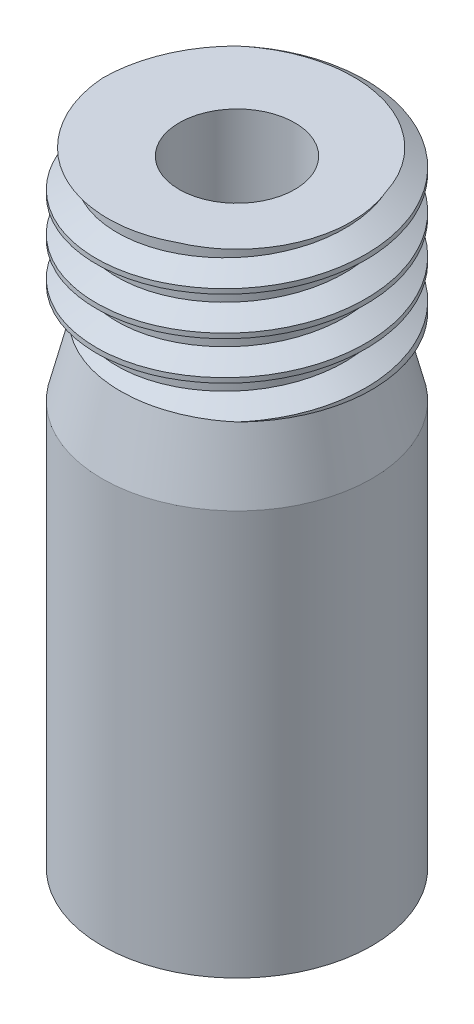
from build123d import *

# Parameters (mm, degrees)
MAINBODYS_R              = 3.5
MAIN_BODY_DEPTH          = 16
CONTACTETCHS_R           = 2.5
CONTACTETCHS_R_2         = 2
CONTACT_ETCH_DEPTH       = 0.01
ARMATURECONTACTS_R       = 1
ARMATURECONTACTS_R_2     = 0.75
ARMATURE_CONTACT_DEPTH   = 0.1
ARMATURETHRUHOLES_R      = 0.75
ARMATURE_THRU_HOLE_DEPTH = 17.748134224
BORES_R                  = 1.5
BORE_DEPTH               = 13
M7_X_5_PITCH             = 1


with BuildPart() as part:
    # MainBodyS → MAIN BODY (new body)
    with BuildSketch(Plane(origin=(0, 0, 0), x_dir=(1, 0, 0), z_dir=(0, 1, 0))):
        with Locations(Location((0, 0, 0), (0, 0, 270))):
            Circle(MAINBODYS_R)
    extrude(amount=MAIN_BODY_DEPTH)

    # ContactEtchS → CONTACT ETCH (cut)
    with BuildSketch(Plane.XZ):
        with Locations(Location((0, 0, 0), (0, 0, 270))):
            Circle(CONTACTETCHS_R)
        with Locations(Location((0, 0, 0), (0, 0, 270))):
            Circle(CONTACTETCHS_R_2, mode=Mode.SUBTRACT)
    extrude(amount=-CONTACT_ETCH_DEPTH, mode=Mode.SUBTRACT)

    # ArmatureContactS → ARMATURE CONTACT (add)
    with BuildSketch(Plane(origin=(0, 0, 0), x_dir=(-1, 0, 0), z_dir=(0, -1, 0))):
        with Locations(Location((0, 0, 0), (0, 0, 270))):
            Circle(ARMATURECONTACTS_R)
        with Locations(Location((0, 0, 0), (0, 0, 90))):
            Circle(ARMATURECONTACTS_R_2, mode=Mode.SUBTRACT)
    extrude(amount=ARMATURE_CONTACT_DEPTH)

    # ArmatureThruHoleS → ARMATURE THRU HOLE (cut, through all)
    with BuildSketch(Plane.XZ):
        with Locations(Location((0, 0, 0), (0, 0, 270))):
            Circle(ARMATURETHRUHOLES_R)
    extrude(amount=-ARMATURE_THRU_HOLE_DEPTH, mode=Mode.SUBTRACT)

    # ThreadCutS → THREAD CUT (revolve, cut)
    with BuildSketch(Plane.XY, mode=Mode.PRIVATE) as thread_cut_sk:
        Polygon((3, 12.5), (3.5, 10.5), (3.5, 12.5), align=None)
    revolve(thread_cut_sk.sketch.rotate(Axis((0, 0, 0), (0, 1, 0)), 90), axis=Axis((0, 0, 0), (0, 1, 0)), mode=Mode.SUBTRACT)

    # BoreS → BORE (cut)
    with BuildSketch(Plane(origin=(0, 16, 0), x_dir=(1, 0, 0), z_dir=(0, 1, 0))):
        with Locations(Location((0, 0, 0), (0, 0, 270))):
            Circle(BORES_R)
    extrude(amount=-BORE_DEPTH, mode=Mode.SUBTRACT)

    # M7 x .5: arcs per turn and ends read off the stored shape
    # M7 x .5: the profile of Thread Profile3 profile screwed along a right-hand helix through 4 turns, 8 arcs to a turn; built about Z, then put on its axis
    m7_x_5_z = Axis((0, 0, 0), (0, 0, 1))
    m7_x_5_corners = [(3.5003, 0, -0.000173205), (3.5003, 0, 0.875173202), (2.958734125, 0, 0.562499999), (2.958734125, 0, 0.312499999)]
    with BuildLine(mode=Mode.PRIVATE) as m7_x_5_profile:
        Line(m7_x_5_corners[0], m7_x_5_corners[1])
        Line(m7_x_5_corners[1], m7_x_5_corners[2])
        Line(m7_x_5_corners[2], m7_x_5_corners[3])
        Line(m7_x_5_corners[3], m7_x_5_corners[0])
    m7_x_5_cap = Face(m7_x_5_profile.wire())
    m7_x_5_turn_angles = [0, 22.5, 45, 67.5, 90, 112.5, 135, 157.5, 180, 202.5, 225, 247.5, 270, 292.5, 315, 337.5, 360]
    m7_x_5_turn_weights = [1, 0.9238795325112867, 1, 0.9238795325112867, 1, 0.9238795325112867, 1, 0.9238795325112867, 1, 0.9238795325112867, 1, 0.9238795325112867, 1, 0.9238795325112867, 1, 0.9238795325112867, 1]
    m7_x_5_turn_rails = [Edge.make_bspline([Vector(p[0], p[1], 0).rotate(m7_x_5_z, m7_x_5_turn_angles[k]) / m7_x_5_turn_weights[k] + Vector(0, 0, p[2] + M7_X_5_PITCH * m7_x_5_turn_angles[k] / 360) for k in range(17)], [0, 0, 0, 1, 1, 2, 2, 3, 3, 4, 4, 5, 5, 6, 6, 7, 7, 8, 8, 8], 2, m7_x_5_turn_weights) for p in m7_x_5_corners]
    m7_x_5_turn_sides = [Face.make_surface_from_curves(m7_x_5_turn_rails[p[0]], m7_x_5_turn_rails[p[1]]) for p in [(0, 1), (1, 2), (2, 3), (3, 0)]]
    m7_x_5 = Plane(origin=(0, 17, 0), x_dir=(-1, 0, 0), z_dir=(0, -1, 0)) * Solid(Shell([*[p.moved(Location((0, 0, M7_X_5_PITCH * i))) for i in range(4) for p in m7_x_5_turn_sides], m7_x_5_cap, m7_x_5_cap.rotate(m7_x_5_z, 1440).moved(Location((0, 0, M7_X_5_PITCH * 1440 / 360)))]))
    add(m7_x_5, mode=Mode.SUBTRACT)


solid = part.part
